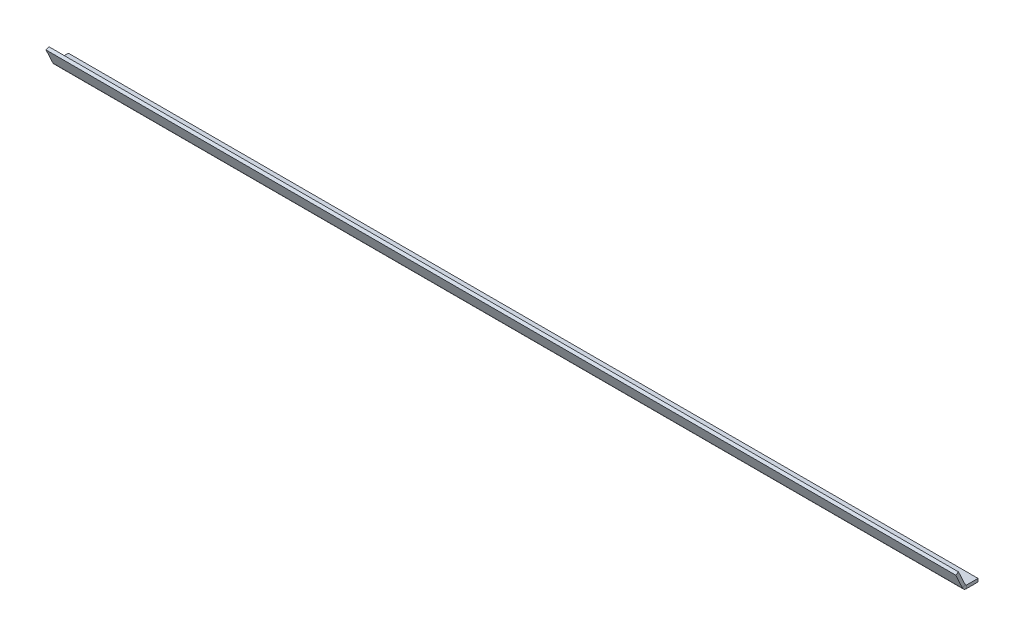
from build123d import *

# Parameters (mm, degrees)
SKETCH2_W            = 2300
SKETCH2_H            = 40
BASE_FLANGE1_DEPTH   = 8
EDGE_FLANGE1_START   = -1150
EDGE_FLANGE1_DEPTH   = 2300
EDGE_FLANGE1_2_DEPTH = 2300


# Read off the part's stored shape, not the designer's step: Edge-Flange1
# Sheet-metal steps are written as plain solids
with BuildPart() as part:
    # Sketch2 → Base-Flange1 (new body)
    with BuildSketch(Plane(origin=(0, 0, 0), x_dir=(1, 0, 0), z_dir=(0, 1, 0))):
        with Locations((0, 20)):
            Rectangle(SKETCH2_W, SKETCH2_H)
    extrude(amount=-BASE_FLANGE1_DEPTH)

    # Edge-Flange1 outline → Edge-Flange1 (cut)
    with BuildSketch(Plane.YZ.offset(EDGE_FLANGE1_START)):
        with BuildLine():
            ThreePointArc((-8, -10.738234134), (-6.277305904, -4.827938442), (-1.648800879, -0.768848477))
            Line((-1.648800879, -0.768848477), (0, 0))
            Line((0, 0), (-8, 0))
            Line((-8, 0), (-8, -10.738234134))
        make_face()
    extrude(amount=EDGE_FLANGE1_DEPTH, mode=Mode.SUBTRACT)

    # Edge-Flange1 2 outline → Edge-Flange1 2 (add)
    with BuildSketch(Plane.YZ.offset(EDGE_FLANGE1_START)):
        with BuildLine():
            Line((35.502773778, 16.555215298), (0, 0))
            Line((0, 0), (0, -10.738234134))
            ThreePointArc((0, -10.738234134), (0.469825663, -9.126335309), (1.732145215, -8.019310773))
            Line((1.732145215, -8.019310773), (38.883719872, 9.304753002))
            Line((38.883719872, 9.304753002), (35.502773778, 16.555215298))
        make_face()
    extrude(amount=EDGE_FLANGE1_2_DEPTH)


solid = part.part
